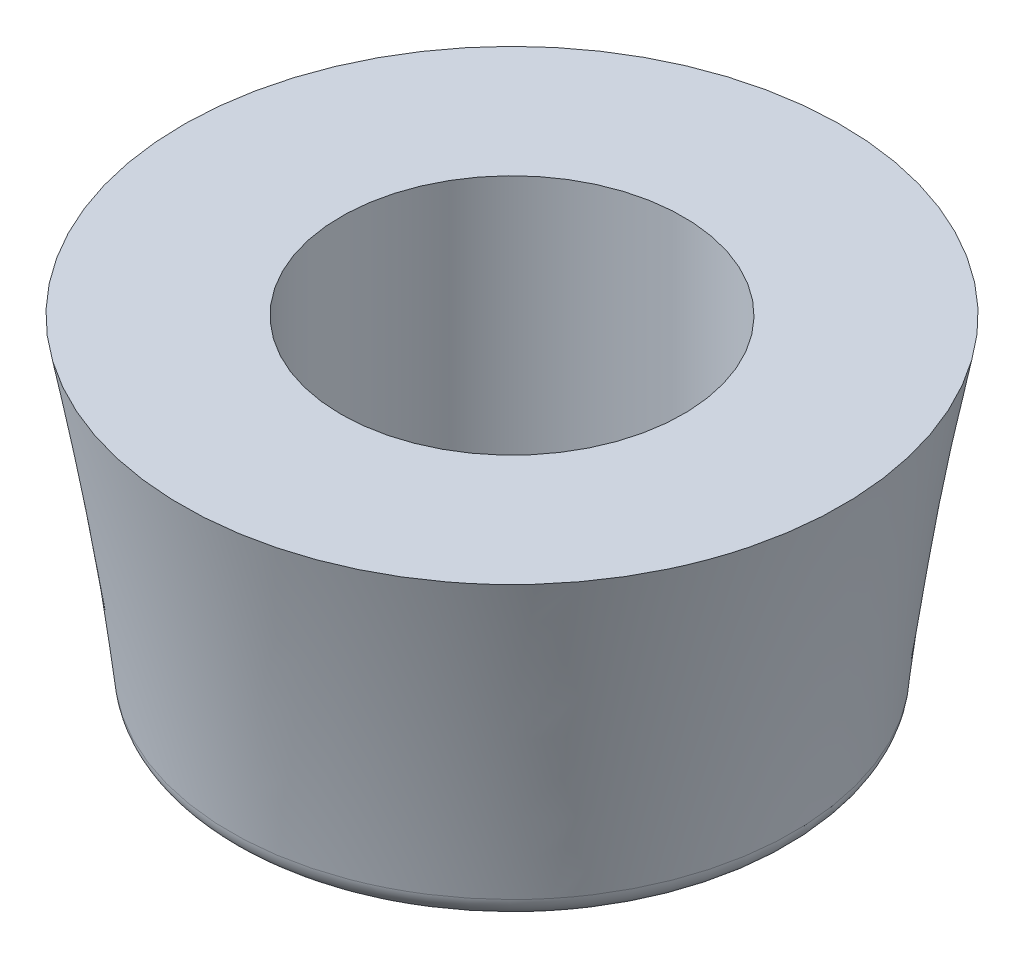
from build123d import *

# Parameters (mm, degrees)
CONG_1_R          = 1
D_GAGEMENT_M121_D = 13.5
CHANFREIN1_SIZE   = 0.5


with BuildPart() as part:
    # Lissage1: read off the stored shape, not the designer's step
    # Lissage1: loft between two sections, ruled curve by curve
    lissage1_from = [
        Edge.make_bspline([(-10.806835439, 13, -7.225808453), (3.644781468, 13, -28.83947933), (25.258452345, 13, -14.387862424), (10.806835439, 13, 7.225808453), (-3.644781468, 13, 28.83947933), (-25.258452345, 13, 14.387862424), (-10.806835439, 13, -7.225808453)], [0, 0, 0, 0, 0.5, 0.5, 0.5, 1, 1, 1, 1], 3, [1, 0.333333333, 0.333333333, 1, 0.333333333, 0.333333333, 1]),
    ]
    lissage1_to = [
        Edge.make_bspline([(-6.654259826, 0, -8.759042537), (10.863825248, 0, -22.06756219), (24.1723449, 0, -4.549477116), (6.654259826, 0, 8.759042537), (-10.863825248, 0, 22.06756219), (-24.1723449, 0, 4.549477116), (-6.654259826, 0, -8.759042537)], [0, 0, 0, 0, 0.5, 0.5, 0.5, 1, 1, 1, 1], 3, [1, 0.333333333, 0.333333333, 1, 0.333333333, 0.333333333, 1]),
    ]
    lissage1 = Solid(Shell([*[Face.make_surface_from_curves(lissage1_from[k], lissage1_to[k]) for k in range(1)], Face(Wire(lissage1_from)), Face(Wire(lissage1_to))]))
    add(lissage1)

    # Congé1
    cong_1_edges = [part.edges().sort_by_distance(p)[0] for p in [
        (6.654259826, 0, 8.759042537),
    ]]
    fillet(cong_1_edges, radius=CONG_1_R)

    # Dégagement M121 (through all)
    with Locations(Plane(origin=(0, 13, 0), x_dir=(1, 0, 0), z_dir=(0, 1, 0))):
        with Locations((0, 0)):
            Hole(D_GAGEMENT_M121_D / 2)

    # Chanfrein1
    chanfrein1_edges = [part.edges().sort_by_distance(p)[0] for p in [
        (6.75, 0, 0),
    ]]
    chamfer(chanfrein1_edges, length=CHANFREIN1_SIZE)


solid = part.part
